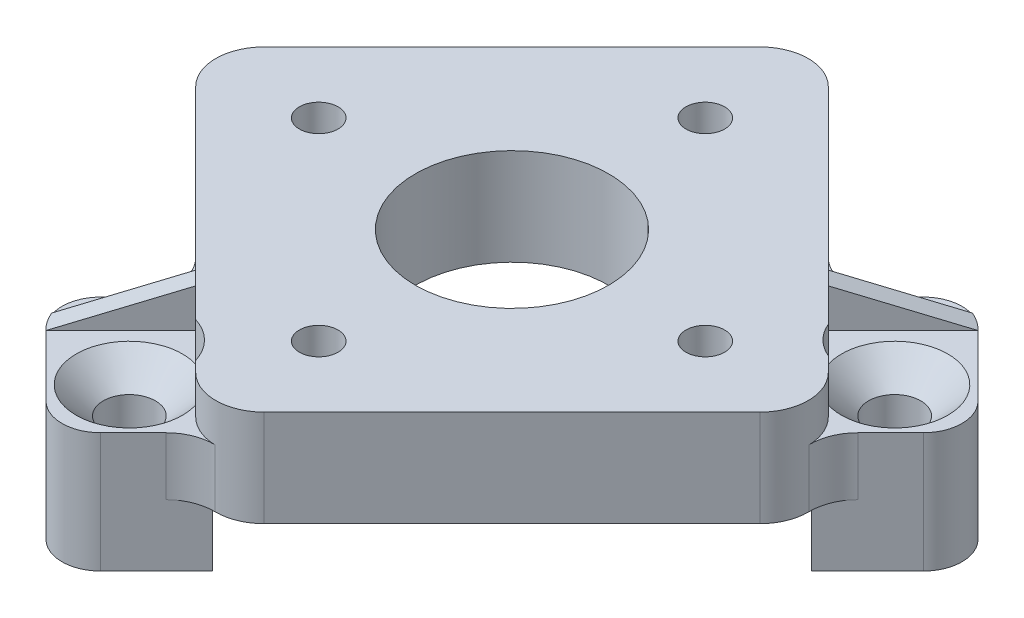
from build123d import *

# Parameters (mm, degrees)
SKETCH1_R                                      = 0.5
SKETCH1_R_2                                    = 5
BOSS_EXTRUDE1_DEPTH                            = 5
BOSS_EXTRUDE4_DEPTH                            = 5.7
BOSS_EXTRUDE4_DEPTH_BACK                       = 0.5
SKETCH3_R                                      = 1.3
BOSS_EXTRUDE6_DEPTH                            = 1
FILLET1_R                                      = 2.5
FILLET2_R                                      = 2
F_2_0MM_DOWEL_HOLE1_D                          = 2
F_2_0MM_DOWEL_HOLE1_DEPTH                      = 42.93
F_2_0MM_DOWEL_HOLE1_TIP                        = 0.600860619
SKETCH12_R                                     = 2.75
SKETCH12_R_2                                   = 2.625
CUT_EXTRUDE1_DEPTH                             = 10
CSK_FOR_M2_5_FLAT_HEAD_MACHINE_SCREW1_AT_COUNT = 2
CSK_FOR_M2_5_FLAT_HEAD_MACHINE_SCREW1_AT_PITCH = 28


with BuildPart() as part:
    # Sketch1 → Boss-Extrude1 (new body)
    with BuildSketch(Plane(origin=(0, 0, 0), x_dir=(1, 0, 0), z_dir=(0, 1, 0))):
        with BuildLine():
            Line((1.767766953, 14.596194078), (14.596194078, 1.767766953))
            ThreePointArc((14.596194078, 1.767766953), (15.328427125, 0), (14.596194078, -1.767766953))
            Line((14.596194078, -1.767766953), (1.767766953, -14.596194078))
            ThreePointArc((1.767766953, -14.596194078), (0, -15.328427125), (-1.767766953, -14.596194078))
            Line((-1.767766953, -14.596194078), (-14.596194078, -1.767766953))
            ThreePointArc((-14.596194078, -1.767766953), (-15.328427125, 0), (-14.596194078, 1.767766953))
            Line((-14.596194078, 1.767766953), (-1.767766953, 14.596194078))
            ThreePointArc((-1.767766953, 14.596194078), (0, 15.328427125), (1.767766953, 14.596194078))
        make_face()
        with Locations(Location((0, 10, 0), (0, 0, 270))):
            Circle(SKETCH1_R, mode=Mode.SUBTRACT)
        with Locations(Location((0, -10, 0), (0, 0, 270))):
            Circle(SKETCH1_R, mode=Mode.SUBTRACT)
        with Locations(Location((10, 0, 0), (0, 0, 270))):
            Circle(SKETCH1_R, mode=Mode.SUBTRACT)
        with Locations(Location((-10, 0, 0), (0, 0, 270))):
            Circle(SKETCH1_R, mode=Mode.SUBTRACT)
        with Locations(Location((0, 0, 0), (0, 0, 270))):
            Circle(SKETCH1_R_2, mode=Mode.SUBTRACT)
    extrude(amount=BOSS_EXTRUDE1_DEPTH)

    # Sketch3 → Boss-Extrude4 (add, two sides: drawn at the far end of the back side and taken through both)
    # profile 1 of 4: a face of its own
    with BuildSketch(Plane(origin=(0, -2.7, 0), x_dir=(1, 0, 0), z_dir=(0, 1, 0)).offset(-BOSS_EXTRUDE4_DEPTH_BACK)):
        Polygon((-4.949747468, -10.537489101), (-0.637994164, -14.849242405), (-4.949747468, -19.160995709), (-9.261500772, -14.849242405), align=None)
        with Locations(Location((-4.949747468, -14.849242405, 0), (0, 0, 270))):
            Circle(SKETCH3_R, mode=Mode.SUBTRACT)
    # profile 2 of 4: a face of its own
    with BuildSketch(Plane(origin=(0, -2.7, 0), x_dir=(1, 0, 0), z_dir=(0, 1, 0)).offset(-BOSS_EXTRUDE4_DEPTH_BACK)):
        Polygon((-6.717514421, -8.769722148), (-11.029267725, -13.081475452), (-9.261500772, -14.849242405), (-4.949747468, -10.537489101), align=None)
    # profile 3 of 4: a face of its own
    with BuildSketch(Plane(origin=(0, -2.7, 0), x_dir=(1, 0, 0), z_dir=(0, 1, 0)).offset(-BOSS_EXTRUDE4_DEPTH_BACK)):
        Polygon((19.160995709, 4.949747468), (14.849242405, 9.261500772), (10.537489101, 4.949747468), (14.849242405, 0.637994164), align=None)
        with Locations(Location((14.849242405, 4.949747468, 0), (0, 0, 270))):
            Circle(SKETCH3_R, mode=Mode.SUBTRACT)
    # profile 4 of 4: a face of its own
    with BuildSketch(Plane(origin=(0, -2.7, 0), x_dir=(1, 0, 0), z_dir=(0, 1, 0)).offset(-BOSS_EXTRUDE4_DEPTH_BACK)):
        Polygon((13.081475452, 11.029267725), (14.849242405, 9.261500772), (10.537489101, 4.949747468), (8.769722148, 6.717514421), align=None)
    extrude(amount=BOSS_EXTRUDE4_DEPTH + BOSS_EXTRUDE4_DEPTH_BACK)


with BuildPart() as boss_extrude6_tool:
    # Sketch7 → Boss-Extrude6 (new body)
    with BuildSketch(Plane(origin=(2.525126055, -2.13e-07, 2.525126055), x_dir=(0.7071067811865474, 0, -0.7071067811865477), z_dir=(0.7071067811865465, -5.960464483662305e-08, 0.7071067811865461))):
        Polygon((11.571067812, 5.000000541), (17.04887, 3.00000056), (11.571067812, 3.000000541), align=None)
        Polygon((-11.571067812, 5.000000541), (-17.04887, 3.00000056), (-11.571067812, 3.000000541), align=None)
    extrude(amount=-BOSS_EXTRUDE6_DEPTH)


with BuildPart() as part_1:
    add(part.part)


with BuildPart() as part_2:
    # Boss-Extrude6: joined with boss_extrude6_tool
    add(part_1.part.fuse(boss_extrude6_tool.part, tol=0.00001))

    # Fillet1
    fillet1_edges = [part_2.edges().sort_by_distance(p)[0] for p in [
        (-7.155876652, 1.5, 9.208084379),
        (-0.935534875, 1.5, 15.146783115),
        (9.208084379, 1.5, -7.155876652),
        (15.146783115, 1.5, -0.935534875),
    ]]
    fillet(fillet1_edges, radius=FILLET1_R)

    # Fillet2
    # the kernel refuses this fillet: 2 mm, written as the material it takes off along each edge
    with BuildSketch(Plane(origin=(-4.949747468, 8, 19.160995709), x_dir=(0.7071067811865477, 0, -0.7071067811865475), z_dir=(0, -1, 0)), Plane(origin=(-11.029267725, -8.2, 13.081475452), x_dir=(0.7071067811865476, 0, -0.7071067811865476), z_dir=(0, 1, 0))) as fillet2_piece_1:
        with BuildLine():
            CenterArc((FILLET2_R, -FILLET2_R), FILLET2_R, 90, 90)
            Line((0, -FILLET2_R), (0, 0))
            Line((0, 0), (FILLET2_R, 0))
        make_face()
    extrude(amount=16.2, mode=Mode.SUBTRACT)
    with BuildSketch(Plane(origin=(13.081475452, -8.2, -11.029267725), x_dir=(-0.7071067811865471, 0, 0.707106781186548), z_dir=(0, 1, 0)), Plane(origin=(19.160995709, 8, -4.949747468), x_dir=(-0.7071067811865472, 0, 0.7071067811865477), z_dir=(0, -1, 0))) as fillet2_piece_2:
        with BuildLine():
            CenterArc((FILLET2_R, FILLET2_R), FILLET2_R, 180, 90)
            Line((0, FILLET2_R), (0, 0))
            Line((0, 0), (FILLET2_R, 0))
        make_face()
    extrude(amount=16.2, mode=Mode.SUBTRACT)

    # Ø2.0mm Dowel Hole1
    with Locations(Plane.XZ):
        with Locations((0, 10), (10, 0), (-10, 0), (0, -10)):
            Hole(F_2_0MM_DOWEL_HOLE1_D / 2, depth=F_2_0MM_DOWEL_HOLE1_DEPTH)
            with Locations((0, 0, -(F_2_0MM_DOWEL_HOLE1_DEPTH + F_2_0MM_DOWEL_HOLE1_TIP / 2))):  # 118° drill point
                Cone(0, F_2_0MM_DOWEL_HOLE1_D / 2, F_2_0MM_DOWEL_HOLE1_TIP, mode=Mode.SUBTRACT)

    # Sketch12 → Cut-Extrude1 (cut)
    with BuildSketch(Plane(origin=(0, 3, 0), x_dir=(1, 0, 0), z_dir=(0, 1, 0))):
        with Locations((-4.949747468, -14.849242405)):
            Circle(SKETCH12_R)
        with Locations((14.849242405, 4.949747468)):
            Circle(SKETCH12_R_2)
    extrude(amount=CUT_EXTRUDE1_DEPTH, mode=Mode.SUBTRACT)

    # Sketch13 → CSK for M2.5 Flat Head Machine Screw1 (revolve, cut)
    with BuildSketch(Plane(origin=(-4.949747468, 3, 14.849242405), x_dir=(0, 0, 1), z_dir=(1, 0, 0))):
        Polygon((0, 0), (0, 43.741161836), (1.35, 42.93), (1.35, 1.4), (2.75, 0), align=None)
    csk_for_m2_5_flat_head_machine_screw1 = revolve(axis=Axis((-4.949747468, 9.35, 14.849242405), (0, -1, 0)), mode=Mode.SUBTRACT)

    # CSK for M2.5 Flat Head Machine Screw1 at: CSK for M2.5 Flat Head Machine Screw1 ×2
    with Locations(*[Vector(0.7071067811865477, 0, -0.7071067811865475) * (i * CSK_FOR_M2_5_FLAT_HEAD_MACHINE_SCREW1_AT_PITCH) for i in range(1, CSK_FOR_M2_5_FLAT_HEAD_MACHINE_SCREW1_AT_COUNT)]):
        add(csk_for_m2_5_flat_head_machine_screw1, mode=Mode.SUBTRACT)


solid = part_2.part
